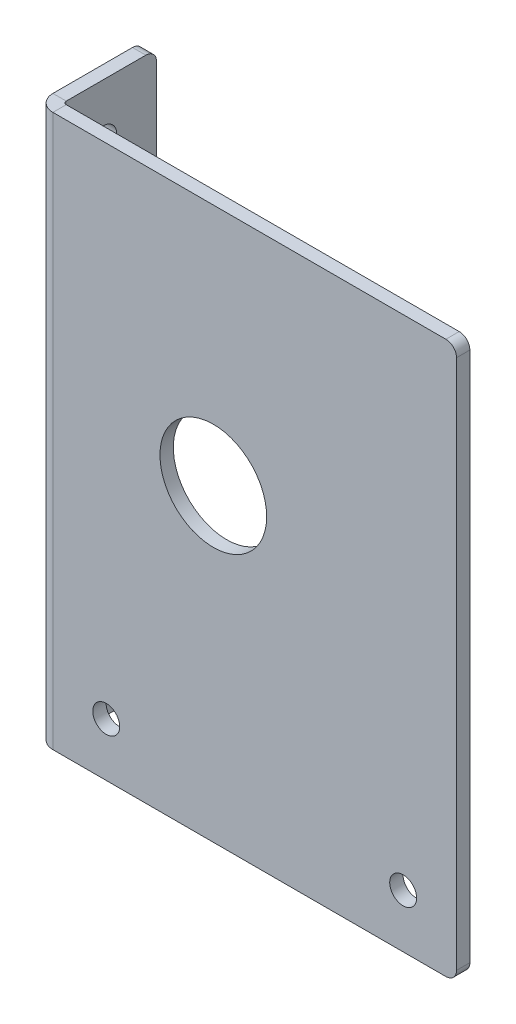
from build123d import *

# Parameters (mm, degrees)
SKETCH1_W                    = 131.4
SKETCH1_H                    = 100
BASE_FLANGE1_DEPTH           = 3.175
EDGE_FLANGE1_STRIP_W         = 14.1732
EDGE_FLANGE1_STRIP_H         = 3.175
EDGE_FLANGE1_STRIP_CUT_DEPTH = 131.4
EDGE_FLANGE1_DEPTH           = 131.4
FILLET1_R                    = 2.54
SKETCH15_R                   = 12.7
MOTOR_HOLE_DEPTH             = 87.380842784
SKETCH9_R                    = 3.205
CUT_EXTRUDE1_DEPTH           = 120.102985899
SKETCH10_R                   = 3.206253706
CUT_EXTRUDE2_DEPTH           = 86.501114759


# Sheet-metal steps are written as plain solids
with BuildPart() as part:
    # Sketch1 → Base-Flange1 (new body)
    with BuildSketch(Plane(origin=(0, 0, 0), x_dir=(0, 1, 0), z_dir=(0, 0, 1))):
        Rectangle(SKETCH1_W, SKETCH1_H)
    extrude(amount=BASE_FLANGE1_DEPTH)

    # Edge-Flange1 strip (across the edge) → Edge-Flange1 strip cut (cut)
    with BuildSketch(Plane(origin=(-50, -65.7, 0), x_dir=(1, 0, 0), z_dir=(0, 1, 0))):
        with Locations((-3.175, -1.5875)):
            Rectangle(EDGE_FLANGE1_STRIP_W, EDGE_FLANGE1_STRIP_H)
    extrude(amount=EDGE_FLANGE1_STRIP_CUT_DEPTH, mode=Mode.SUBTRACT)

    # Edge-Flange1 section (across the edge) → Edge-Flange1 (add)
    with BuildSketch(Plane(origin=(-50, -65.7, 0), x_dir=(1, 0, 0), z_dir=(0, 1, 0))):
        with BuildLine():
            Line((0, 0.7366), (0, 22.225))
            Line((0, 22.225), (3.175, 22.225))
            Line((3.175, 22.225), (3.175, 0.7366))
            ThreePointArc((3.175, 0.7366), (3.390745145, 0.215745145), (3.9116, 0))
            Line((3.9116, 0), (3.9116, -3.175))
            ThreePointArc((3.9116, -3.175), (1.145681115, -2.029318885), (0, 0.7366))
        make_face()
    extrude(amount=EDGE_FLANGE1_DEPTH)

    # Fillet1
    fillet1_edges = [part.edges().sort_by_distance(p)[0] for p in [
        (-48.4125, -65.7, -22.225),
        (-48.4125, 65.7, -22.225),
        (50, 65.7, 1.5875),
        (50, -65.7, 1.5875),
    ]]
    fillet(fillet1_edges, radius=FILLET1_R)

    # Sketch15 → Motor Hole (cut, through all)
    with BuildSketch(Plane.XY.offset(3.175)):
        with Locations((-7.9, 7.8)):
            Circle(SKETCH15_R)
    extrude(amount=-MOTOR_HOLE_DEPTH, mode=Mode.SUBTRACT)

    # Sketch9 → Cut-Extrude1 (cut, through all)
    with BuildSketch(Plane.YZ.offset(-46.825)):
        with Locations(Location((53, -9.525, 0), (0, 0, 270))):
            Circle(SKETCH9_R)
    cut_extrude1 = extrude(amount=-CUT_EXTRUDE1_DEPTH, mode=Mode.SUBTRACT)

    # Mirror1: Cut-Extrude1 across plane
    add(cut_extrude1.mirror(Plane.ZX), mode=Mode.SUBTRACT)

    # Sketch10 → Cut-Extrude2 (cut, through all)
    with BuildSketch(Plane(origin=(0, 0, 0), x_dir=(1, 0, 0), z_dir=(0, 0, -1))):
        with Locations(Location((-33.3884, 53, 0), (0, 0, 180))):
            Circle(SKETCH10_R)
        with Locations(Location((37.3, 53, 0), (0, 0, 180))):
            Circle(SKETCH10_R)
    extrude(amount=-CUT_EXTRUDE2_DEPTH, mode=Mode.SUBTRACT)


solid = part.part
